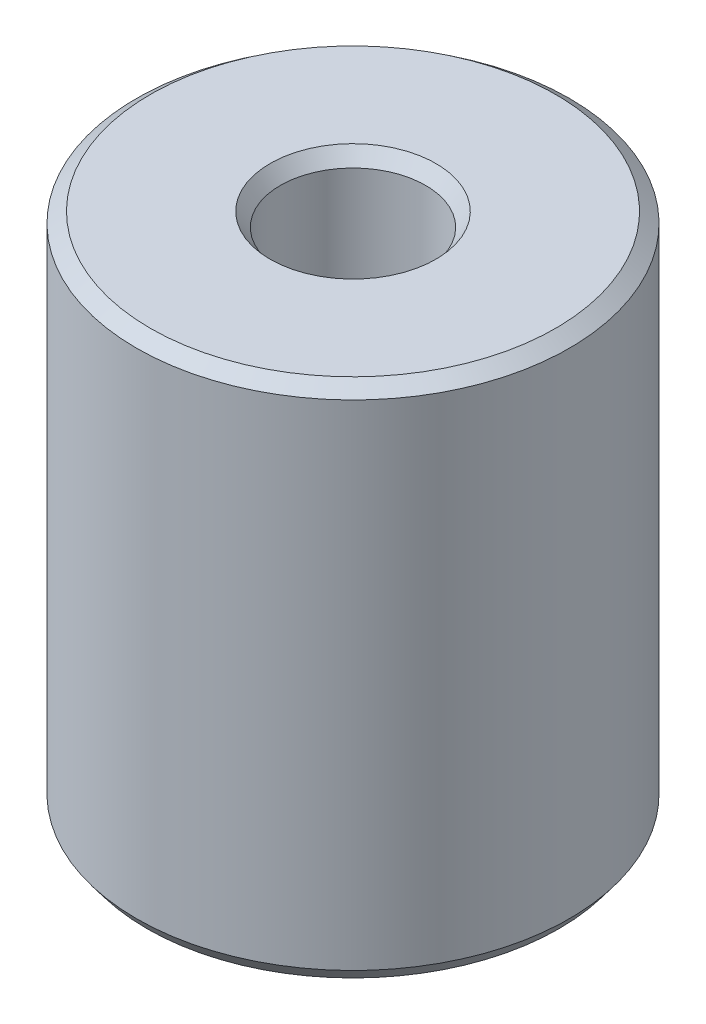
from build123d import *
from OCP.BRepFilletAPI import BRepFilletAPI_MakeChamfer

# Parameters (mm, degrees)
SKETCH1_R           = 10
BOSS_EXTRUDE1_DEPTH = 23.943667728
SKETCH2_R           = 3.356295362
CUT_EXTRUDE1_DEPTH  = 28.808258203
CHAMFER1_SIZE       = 0.476712324
CHAMFER1_SIZE2      = 0.637220412


with BuildPart() as part:
    # Sketch1 → Boss-Extrude1 (new body)
    with BuildSketch(Plane(origin=(0, 0, 0), x_dir=(1, 0, 0), z_dir=(0, 1, 0))):
        Circle(SKETCH1_R)
    extrude(amount=BOSS_EXTRUDE1_DEPTH)

    # Sketch2 → Cut-Extrude1 (cut, through all)
    with BuildSketch(Plane(origin=(0, 0, 0), x_dir=(1, 0, 0), z_dir=(0, 1, 0))):
        Circle(SKETCH2_R)
    extrude(amount=CUT_EXTRUDE1_DEPTH, mode=Mode.SUBTRACT)

    # Chamfer1: one chamfer whose edges measure the first distance from different faces: ONE call of the kernel's chamfer builder (chamfer() names one face for all edges)
    chamfer1_edges_1 = [part.edges().sort_by_distance(p)[0] for p in [
        (-3.356295362, 23.943667728, 0),
    ]]
    chamfer1_side_1 = [part.faces().sort_by_distance(p)[0] for p in [
        (-9.717157288, 23.943667728, 0),
    ]]
    chamfer1_edges_2 = [part.edges().sort_by_distance(p)[0] for p in [
        (-3.356295362, 0, 0),
    ]]
    chamfer1_side_2 = [part.faces().sort_by_distance(p)[0] for p in [
        (-3.356295362, 11.971833864, 0),
    ]]
    chamfer1_edges_3 = [part.edges().sort_by_distance(p)[0] for p in [
        (-10, 0, 0),
    ]]
    chamfer1_side_3 = [part.faces().sort_by_distance(p)[0] for p in [
        (-9.717157288, 0, 0),
    ]]
    chamfer1_edges_4 = [part.edges().sort_by_distance(p)[0] for p in [
        (-10, 23.943667728, 0),
    ]]
    chamfer1_side_4 = [part.faces().sort_by_distance(p)[0] for p in [
        (-10, 11.971833864, 0),
    ]]
    chamfer1 = BRepFilletAPI_MakeChamfer(part.part.solid().wrapped)
    for e in chamfer1_edges_1:
        chamfer1.Add(CHAMFER1_SIZE, CHAMFER1_SIZE2, e.wrapped, chamfer1_side_1[0].wrapped)  # the first distance lies on this face
    for e in chamfer1_edges_2:
        chamfer1.Add(CHAMFER1_SIZE, CHAMFER1_SIZE2, e.wrapped, chamfer1_side_2[0].wrapped)  # the first distance lies on this face
    for e in chamfer1_edges_3:
        chamfer1.Add(CHAMFER1_SIZE, CHAMFER1_SIZE2, e.wrapped, chamfer1_side_3[0].wrapped)  # the first distance lies on this face
    for e in chamfer1_edges_4:
        chamfer1.Add(CHAMFER1_SIZE, CHAMFER1_SIZE2, e.wrapped, chamfer1_side_4[0].wrapped)  # the first distance lies on this face
    add(Compound.cast(chamfer1.Shape()), mode=Mode.REPLACE)


solid = part.part
